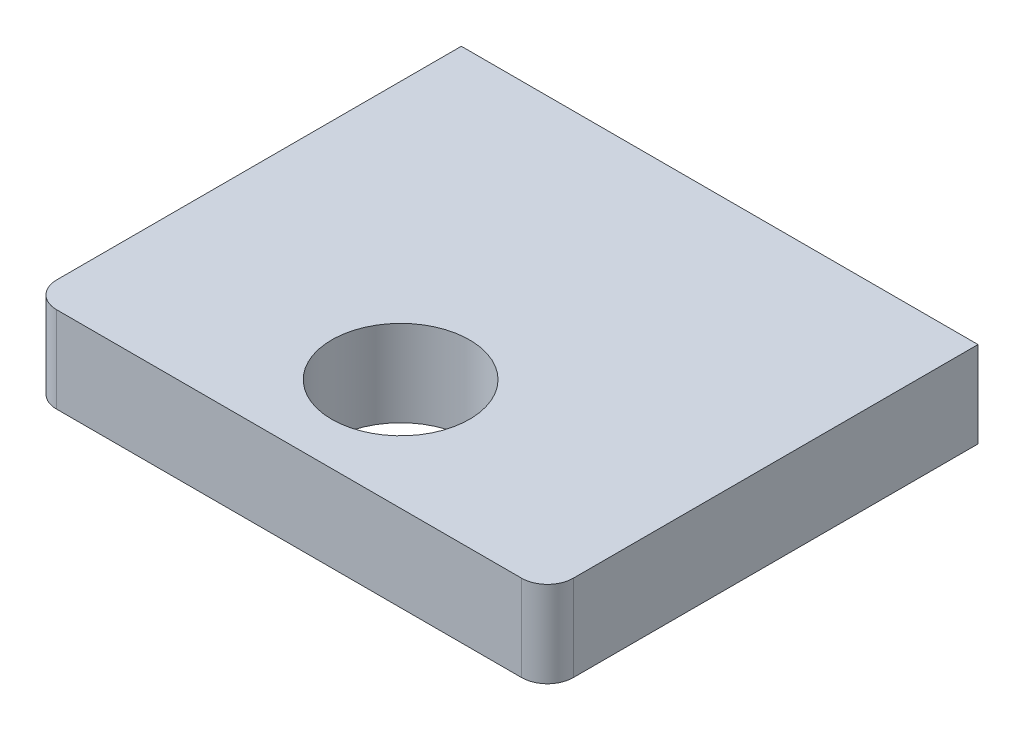
from build123d import *

# Parameters (mm, degrees)
SKETCH_1_W          = 60
SKETCH_1_H          = 50
EXTRUDE_1_DEPTH     = 10
SKETCH_2_R          = 4
CUT_EXTRUDE_1_DEPTH = 0.5
FILLET_1_R          = 3
SKETCH_3_R          = 8
CUT_EXTRUDE_2_DEPTH = 41.311288741


with BuildPart() as part:
    # 草图1 → 凸台-拉伸1 (new body)
    with BuildSketch(Plane(origin=(0, 0, 0), x_dir=(1, 0, 0), z_dir=(0, 1, 0))):
        Rectangle(SKETCH_1_W, SKETCH_1_H)
    extrude(amount=EXTRUDE_1_DEPTH)

    # 草图2 → 切除-拉伸1 (cut)
    with BuildSketch(Plane.XZ):
        with Locations((-18, 16.9)):
            Circle(SKETCH_2_R)
        with Locations((18, 16.9)):
            Circle(SKETCH_2_R)
    extrude(amount=-CUT_EXTRUDE_1_DEPTH, mode=Mode.SUBTRACT)

    # 圆角1
    fillet_1_edges = [part.edges().sort_by_distance(p)[0] for p in [
        (30, 5, 25),
        (-30, 5, 25),
    ]]
    fillet(fillet_1_edges, radius=FILLET_1_R)

    # 草图3 → 切除-拉伸2 (cut, through all)
    with BuildSketch(Plane(origin=(0, 10, 0), x_dir=(1, 0, 0), z_dir=(0, 1, 0))):
        with Locations((0, -12.05)):
            Circle(SKETCH_3_R)
    extrude(amount=-CUT_EXTRUDE_2_DEPTH, mode=Mode.SUBTRACT)


solid = part.part
